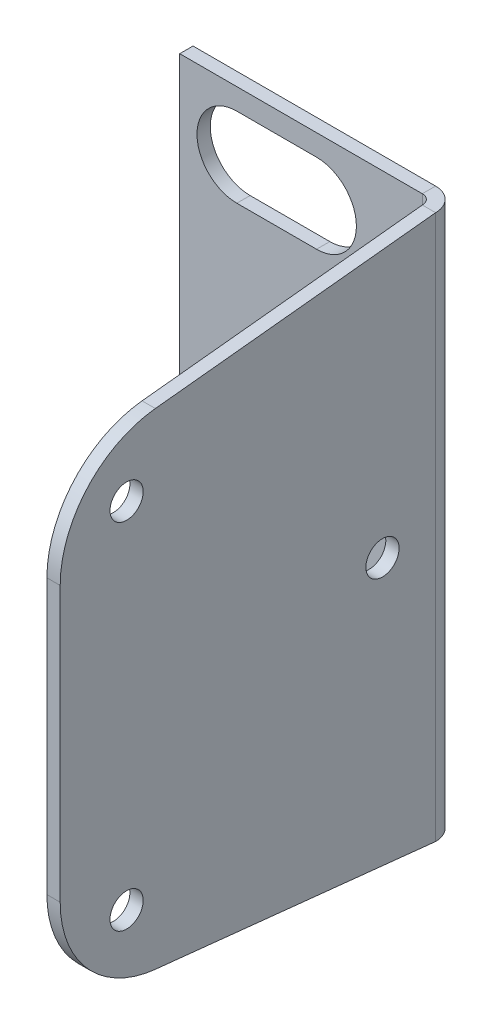
from build123d import *

# Parameters (mm, degrees)
SKETCH1_W                    = 20
SKETCH1_H                    = 20.5
BASE_FLANGE1_DEPTH           = 1
EDGE_FLANGE1_STRIP_W         = 5.4732
EDGE_FLANGE1_STRIP_H         = 1
EDGE_FLANGE1_STRIP_CUT_DEPTH = 20.5
EDGE_FLANGE1_DEPTH           = 20.5
CUT_EXTRUDE1_DEPTH           = 42.003048667
CUT_EXTRUDE1_DEPTH_BACK      = 10
CUT_EXTRUDE2_DEPTH           = 1
M3_TAPPED_HOLE1_D            = 2.5


# Sheet-metal steps are written as plain solids
with BuildPart() as part:
    # Sketch1 → Base-Flange1 (new body)
    with BuildSketch(Plane.XY):
        with Locations((-229.8, 10.25)):
            Rectangle(SKETCH1_W, SKETCH1_H)
    extrude(amount=BASE_FLANGE1_DEPTH)

    # Edge-Flange1 strip (across the edge) → Edge-Flange1 strip cut (cut)
    with BuildSketch(Plane(origin=(-219.8, 0, 1), x_dir=(-1, 0, 0), z_dir=(0, 1, 0))):
        with Locations((-1, -0.5)):
            Rectangle(EDGE_FLANGE1_STRIP_W, EDGE_FLANGE1_STRIP_H)
    extrude(amount=EDGE_FLANGE1_STRIP_CUT_DEPTH, mode=Mode.SUBTRACT)

    # Edge-Flange1 section (across the edge) → Edge-Flange1 (add)
    with BuildSketch(Plane(origin=(-219.8, 0, 1), x_dir=(-1, 0, 0), z_dir=(0, 1, 0))):
        with BuildLine():
            Line((0, 0.7366), (0, 29))
            Line((0, 29), (1, 29))
            Line((1, 29), (1, 0.7366))
            ThreePointArc((1, 0.7366), (1.215745145, 0.215745145), (1.7366, 0))
            Line((1.7366, 0), (1.7366, -1))
            ThreePointArc((1.7366, -1), (0.508638364, -0.491361636), (0, 0.7366))
        make_face()
    extrude(amount=EDGE_FLANGE1_DEPTH)

    # Sketch9 → Cut-Extrude1 (cut, two sides: drawn at the far end of the back side and taken through both)
    with BuildSketch(Plane.ZY.offset(220.8).offset(-CUT_EXTRUDE1_DEPTH_BACK)):
        with BuildLine():
            Line((-80.481011606, 29.141419193), (1.7366, 20.5))
            Line((1.7366, 20.5), (22.836227706, 18.282339766))
            ThreePointArc((22.836227706, 18.282339766), (27.945158604, 15.679209453), (30, 10.326164603))
            Line((30, 10.326164603), (30, 0))
            Line((30, 0), (30, -82.670489196))
            Line((30, -82.670489196), (147.611596884, 33.541177232))
            Line((147.611596884, 33.541177232), (37.130585278, 145.353085621))
            Line((37.130585278, 145.353085621), (-80.481011606, 29.141419193))
        make_face()
    extrude(amount=CUT_EXTRUDE1_DEPTH + CUT_EXTRUDE1_DEPTH_BACK, mode=Mode.SUBTRACT)

    # Sketch11 → Cut-Extrude2 (cut)
    with BuildSketch(Plane.XY.offset(1)):
        with BuildLine():
            Line((-229.5, 18.9), (-235.5, 18.9))
            ThreePointArc((-235.5, 18.9), (-238.5, 15.9), (-235.5, 12.9))
            Line((-235.5, 12.9), (-229.5, 12.9))
            ThreePointArc((-229.5, 12.9), (-226.5, 15.9), (-229.5, 18.9))
        make_face()
    extrude(amount=-CUT_EXTRUDE2_DEPTH, mode=Mode.SUBTRACT)

    # Mirror1: part across plane


with BuildPart() as part_1:
    add(part.part)
    add(part.part.mirror(Plane(origin=(-239.8, 0, 1), x_dir=(0, 0, 1), z_dir=(0, 1, 0))))

    # M3 Tapped Hole1 (through all)
    with Locations(Plane.ZY.offset(220.8)):
        with Locations((5.7366, 0), (25, 13.326164603), (25, -13.326164603)):
            Hole(M3_TAPPED_HOLE1_D / 2)


solid = part_1.part
